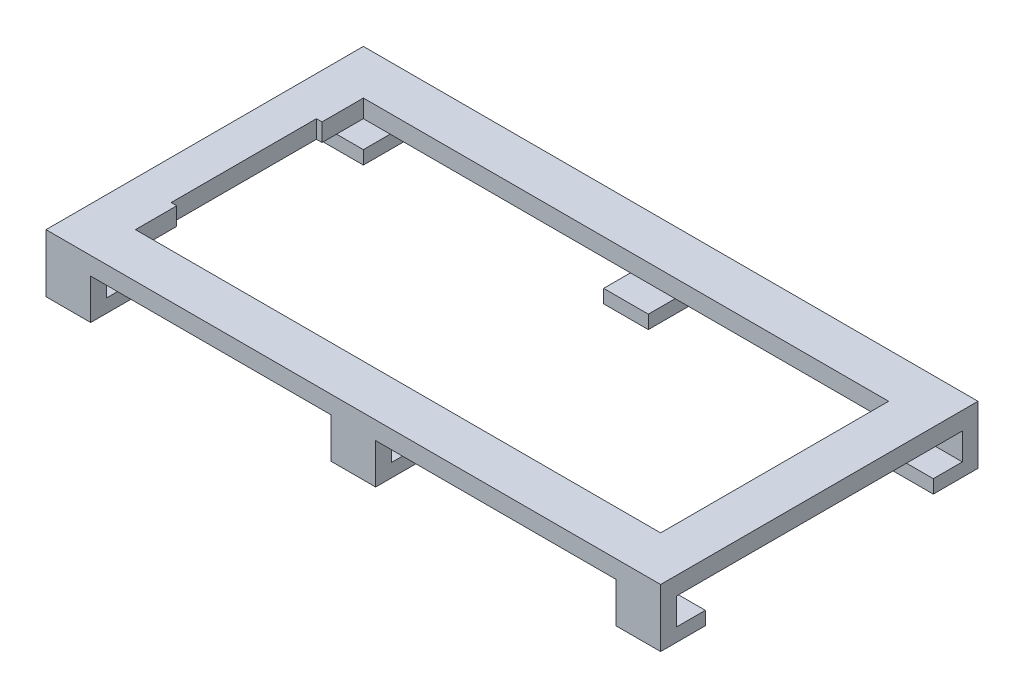
from build123d import *

# Parameters (mm, degrees)
CROQUIS1_W              = 275
CROQUIS1_H              = 142
CROQUIS1_W_2            = 235
CROQUIS1_H_2            = 102
SALIENTE_EXTRUIR1_DEPTH = 8
SALIENTE_EXTRUIR2_DEPTH = 20
SIMETR_A2_COPY_1_DEPTH  = 20
SIMETR_A2_COPY_2_DEPTH  = 20
CROQUIS3_W              = 60
CROQUIS3_H              = 65
CORTAR_EXTRUIR1_DEPTH   = 157.917972202
SALIENTE_EXTRUIR3_DEPTH = 10


with BuildPart() as part:
    # Croquis1 → Saliente-Extruir1 (new body)
    with BuildSketch(Plane(origin=(0, 0, 0), x_dir=(1, 0, 0), z_dir=(0, 1, 0))):
        Rectangle(CROQUIS1_W, CROQUIS1_H)
        Rectangle(CROQUIS1_W_2, CROQUIS1_H_2, mode=Mode.SUBTRACT)
    extrude(amount=SALIENTE_EXTRUIR1_DEPTH)

    # Croquis2 → Saliente-Extruir2 (add)
    with BuildSketch(Plane.ZY.offset(137.5)):
        Polygon((71, 0), (71, -18), (51, -18), (51, -12), (64, -12), (64, 0), align=None)
    saliente_extruir2 = extrude(amount=-SALIENTE_EXTRUIR2_DEPTH)

    # Simetría1: Saliente-Extruir2 across plane
    add(saliente_extruir2.mirror(Plane(origin=(0, 0, 0), x_dir=(0, 0, 1), z_dir=(1, 0, 0))))

    # Simetría2 copy 1 sketch → Simetría2 copy 1 (add)
    with BuildSketch(Plane(origin=(137.5, 0, 0), x_dir=(0, 0, -1), z_dir=(1, 0, 0))):
        Polygon((71, 0), (71, -18), (51, -18), (51, -12), (64, -12), (64, 0), align=None)
    extrude(amount=-SIMETR_A2_COPY_1_DEPTH)

    # Simetría2 copy 2 sketch → Simetría2 copy 2 (add)
    with BuildSketch(Plane(origin=(-137.5, 0, 0), x_dir=(0, 0, -1), z_dir=(-1, 0, 0))):
        Polygon((71, 0), (71, 18), (51, 18), (51, 12), (64, 12), (64, 0), align=None)
    extrude(amount=-SIMETR_A2_COPY_2_DEPTH)

    # Croquis3 → Cortar-Extruir1 (cut, through all)
    with BuildSketch(Plane(origin=(0, 8, 0), x_dir=(1, 0, 0), z_dir=(0, 1, 0))):
        with Locations((-90, 0)):
            Rectangle(CROQUIS3_W, CROQUIS3_H)
    extrude(amount=-CORTAR_EXTRUIR1_DEPTH, mode=Mode.SUBTRACT)

    # Croquis4 → Saliente-Extruir3 (add, symmetric)
    with BuildSketch(Plane(origin=(0, 0, 0), x_dir=(0, 0, -1), z_dir=(1, 0, 0))):
        Polygon((-51, -18), (-71, -18), (-71, 0), (-64, 0), (-64, -12), (-51, -12), align=None)
    saliente_extruir3 = extrude(amount=SALIENTE_EXTRUIR3_DEPTH, both=True)

    # Simetría4: Saliente-Extruir3 across plane
    add(saliente_extruir3.mirror(Plane.XY))


solid = part.part
